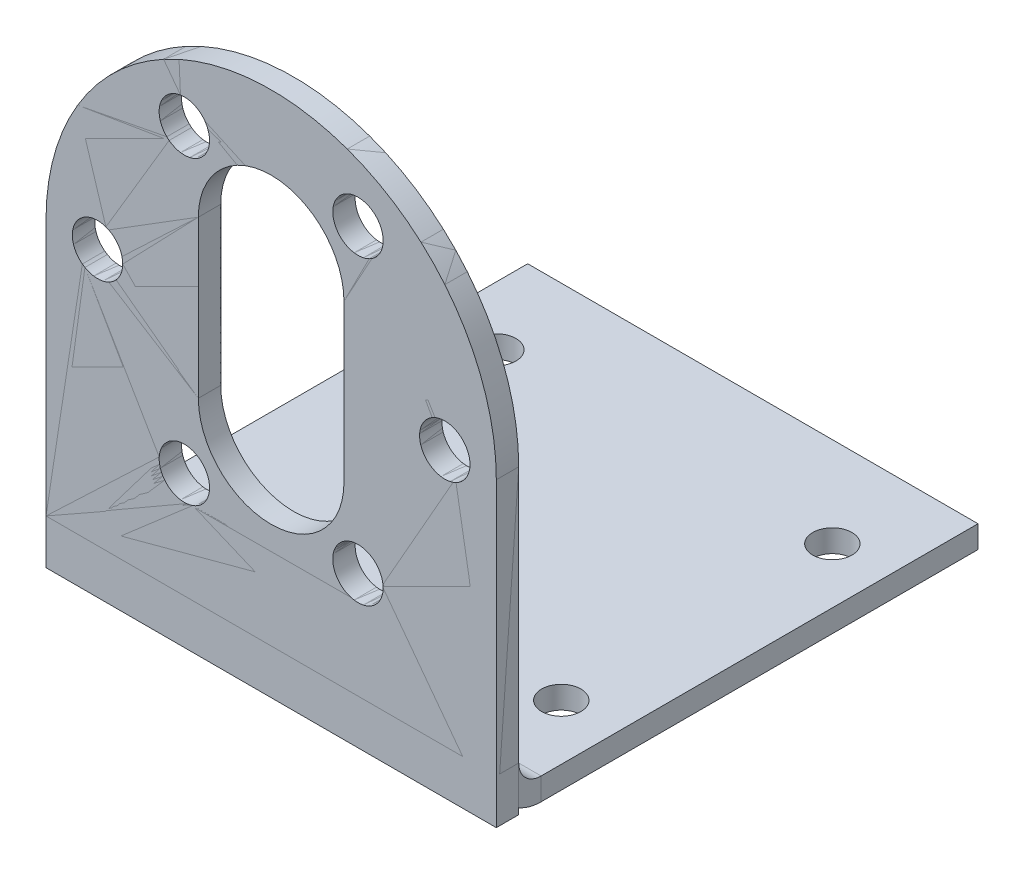
from build123d import *

# Parameters (mm, degrees)
EXTRUDE_1_DEPTH                  = 2
CUT_EXTRUDE_1_REACH              = 35.64
SKETCH_2_R                       = 2.25
CUT_EXTRUDE_2_REACH              = 35.64
SHEET_METAL_2_OUTLINE_R          = 2.25
SHEET_METAL_2_DEPTH              = 2
SM_EDGE_FLANGE_1_STRIP_W         = 12
SM_EDGE_FLANGE_1_STRIP_H         = 2
SM_EDGE_FLANGE_1_STRIP_CUT_DEPTH = 40.2
SM_EDGE_FLANGE_1_DEPTH           = 40.2
SKETCH_12_R                      = 1.75
CUT_EXTRUDE_3_DEPTH              = 2


# Read off the part's stored shape, not the designer's step: 转换实体2
# Sheet-metal steps are written as plain solids
with BuildPart() as part:
    # 草图1 → 凸台-拉伸1 (new body)
    with BuildSketch(Plane.XY):
        with BuildLine():
            Line((-20.1, 0), (-20.1, -26.9))
            Line((-20.1, -26.9), (20.1, -26.9))
            Line((20.1, -26.9), (20.1, 0))
            ThreePointArc((20.1, 0), (0, 20.1), (-20.1, 0))
        make_face()
    extrude(amount=EXTRUDE_1_DEPTH)

    # Sketch 2 → 切除-拉伸1 (cut, up to next)
    with BuildSketch(Plane.XY.offset(2), mode=Mode.PRIVATE) as cut_extrude_1_sk1:
        with Locations((-15.5, 0)):
            Circle(SKETCH_2_R)
    cut_extrude_1_tool1 = extrude(cut_extrude_1_sk1.sketch, amount=-CUT_EXTRUDE_1_REACH, mode=Mode.PRIVATE) & part.part
    # Sketch 2 → 切除-拉伸1 (cut, up to next)
    with BuildSketch(Plane.XY.offset(2), mode=Mode.PRIVATE) as cut_extrude_1_sk2:
        with Locations((-7.75, 13.423393759)):
            Circle(SKETCH_2_R)
    cut_extrude_1_tool2 = extrude(cut_extrude_1_sk2.sketch, amount=-CUT_EXTRUDE_1_REACH, mode=Mode.PRIVATE) & part.part
    # Sketch 2 → 切除-拉伸1 (cut, up to next)
    with BuildSketch(Plane.XY.offset(2), mode=Mode.PRIVATE) as cut_extrude_1_sk3:
        with Locations((7.75, 13.423393759)):
            Circle(SKETCH_2_R)
    cut_extrude_1_tool3 = extrude(cut_extrude_1_sk3.sketch, amount=-CUT_EXTRUDE_1_REACH, mode=Mode.PRIVATE) & part.part
    # Sketch 2 → 切除-拉伸1 (cut, up to next)
    with BuildSketch(Plane.XY.offset(2), mode=Mode.PRIVATE) as cut_extrude_1_sk4:
        with Locations((15.5, 0)):
            Circle(SKETCH_2_R)
    cut_extrude_1_tool4 = extrude(cut_extrude_1_sk4.sketch, amount=-CUT_EXTRUDE_1_REACH, mode=Mode.PRIVATE) & part.part
    # Sketch 2 → 切除-拉伸1 (cut, up to next)
    with BuildSketch(Plane.XY.offset(2), mode=Mode.PRIVATE) as cut_extrude_1_sk5:
        with Locations((7.75, -13.423393759)):
            Circle(SKETCH_2_R)
    cut_extrude_1_tool5 = extrude(cut_extrude_1_sk5.sketch, amount=-CUT_EXTRUDE_1_REACH, mode=Mode.PRIVATE) & part.part
    # Sketch 2 → 切除-拉伸1 (cut, up to next)
    with BuildSketch(Plane.XY.offset(2), mode=Mode.PRIVATE) as cut_extrude_1_sk6:
        with Locations((-7.75, -13.423393759)):
            Circle(SKETCH_2_R)
    cut_extrude_1_tool6 = extrude(cut_extrude_1_sk6.sketch, amount=-CUT_EXTRUDE_1_REACH, mode=Mode.PRIVATE) & part.part
    add(cut_extrude_1_tool1.solids().sort_by_distance((-15.5, 0, 2))[0], mode=Mode.SUBTRACT)
    add(cut_extrude_1_tool2.solids().sort_by_distance((-7.75, 13.423394, 2))[0], mode=Mode.SUBTRACT)
    add(cut_extrude_1_tool3.solids().sort_by_distance((7.75, 13.423394, 2))[0], mode=Mode.SUBTRACT)
    add(cut_extrude_1_tool4.solids().sort_by_distance((15.5, 0, 2))[0], mode=Mode.SUBTRACT)
    add(cut_extrude_1_tool5.solids().sort_by_distance((7.75, -13.423394, 2))[0], mode=Mode.SUBTRACT)
    add(cut_extrude_1_tool6.solids().sort_by_distance((-7.75, -13.423394, 2))[0], mode=Mode.SUBTRACT)

    # 草图3 → 切除-拉伸2 (cut, up to next)
    with BuildSketch(Plane.XY.offset(2), mode=Mode.PRIVATE) as cut_extrude_2_sk1:
        with BuildLine():
            Line((-6.5, 7), (-6.5, -7))
            ThreePointArc((-6.5, -7), (0, -13.5), (6.5, -7))
            Line((6.5, -7), (6.5, 7))
            ThreePointArc((6.5, 7), (0, 13.5), (-6.5, 7))
        make_face()
    cut_extrude_2_tool1 = extrude(cut_extrude_2_sk1.sketch, amount=-CUT_EXTRUDE_2_REACH, mode=Mode.PRIVATE) & part.part
    add(cut_extrude_2_tool1.solids().sort_by_distance((0, 0, 2))[0], mode=Mode.SUBTRACT)


with BuildPart() as body_2:
    # Sheet Metal 2 outline → Sheet Metal 2 (new body)
    with BuildSketch(Plane.XY):
        with BuildLine():
            ThreePointArc((20.1, 0), (0, 20.1), (-20.1, 0))
            Line((-20.1, 0), (-20.1, -26.9))
            Line((-20.1, -26.9), (20.1, -26.9))
            Line((20.1, -26.9), (20.1, 0))
        make_face()
        with Locations((-7.75, -13.423393759)):
            Circle(SHEET_METAL_2_OUTLINE_R, mode=Mode.SUBTRACT)
        with Locations((7.75, -13.423393759)):
            Circle(SHEET_METAL_2_OUTLINE_R, mode=Mode.SUBTRACT)
        with Locations((-15.5, 0)):
            Circle(SHEET_METAL_2_OUTLINE_R, mode=Mode.SUBTRACT)
        with Locations((-7.75, 13.423393759)):
            Circle(SHEET_METAL_2_OUTLINE_R, mode=Mode.SUBTRACT)
        with BuildLine():
            ThreePointArc((-6.5, 7), (0, 13.5), (6.5, 7))
            Line((6.5, 7), (6.5, -7))
            ThreePointArc((6.5, -7), (0, -13.5), (-6.5, -7))
            Line((-6.5, -7), (-6.5, 7))
        make_face(mode=Mode.SUBTRACT)
        with Locations((15.5, 0)):
            Circle(SHEET_METAL_2_OUTLINE_R, mode=Mode.SUBTRACT)
        with Locations((7.75, 13.423393759)):
            Circle(SHEET_METAL_2_OUTLINE_R, mode=Mode.SUBTRACT)
    extrude(amount=SHEET_METAL_2_DEPTH)

    # 边线-法兰1 strip (across the edge) → 边线-法兰1 strip cut (cut)
    with BuildSketch(Plane(origin=(20.1, -26.9, 0), x_dir=(0, 1, 0), z_dir=(-1, 0, 0))):
        with Locations((-2, -1)):
            Rectangle(SM_EDGE_FLANGE_1_STRIP_W, SM_EDGE_FLANGE_1_STRIP_H)
    extrude(amount=SM_EDGE_FLANGE_1_STRIP_CUT_DEPTH, mode=Mode.SUBTRACT)

    # 边线-法兰1 section (across the edge) → 边线-法兰1 (add)
    with BuildSketch(Plane(origin=(20.1, -26.9, 0), x_dir=(0, 1, 0), z_dir=(-1, 0, 0))):
        with BuildLine():
            Line((0, 2), (0, 41))
            Line((0, 41), (2, 41))
            Line((2, 41), (2, 2))
            ThreePointArc((2, 2), (2.585786438, 0.585786438), (4, 0))
            Line((4, 0), (4, -2))
            ThreePointArc((4, -2), (1.171572875, -0.828427125), (0, 2))
        make_face()
    extrude(amount=SM_EDGE_FLANGE_1_DEPTH)

    # 草图12 → 切除-拉伸3 (cut)
    with BuildSketch(Plane(origin=(0, -26.9, 0), x_dir=(-1, 0, 0), z_dir=(0, -1, 0))):
        with Locations(Location((14.85, 32.95, 0), (0, 0, 90))):
            Circle(SKETCH_12_R)
        with Locations(Location((-15.15, 32.95, 0), (0, 0, 90))):
            Circle(SKETCH_12_R)
        with Locations(Location((-15.15, 8.75, 0), (0, 0, 90))):
            Circle(SKETCH_12_R)
        with Locations(Location((14.85, 8.75, 0), (0, 0, 90))):
            Circle(SKETCH_12_R)
    extrude(amount=-CUT_EXTRUDE_3_DEPTH, mode=Mode.SUBTRACT)


solid = Compound([part.part, body_2.part])
